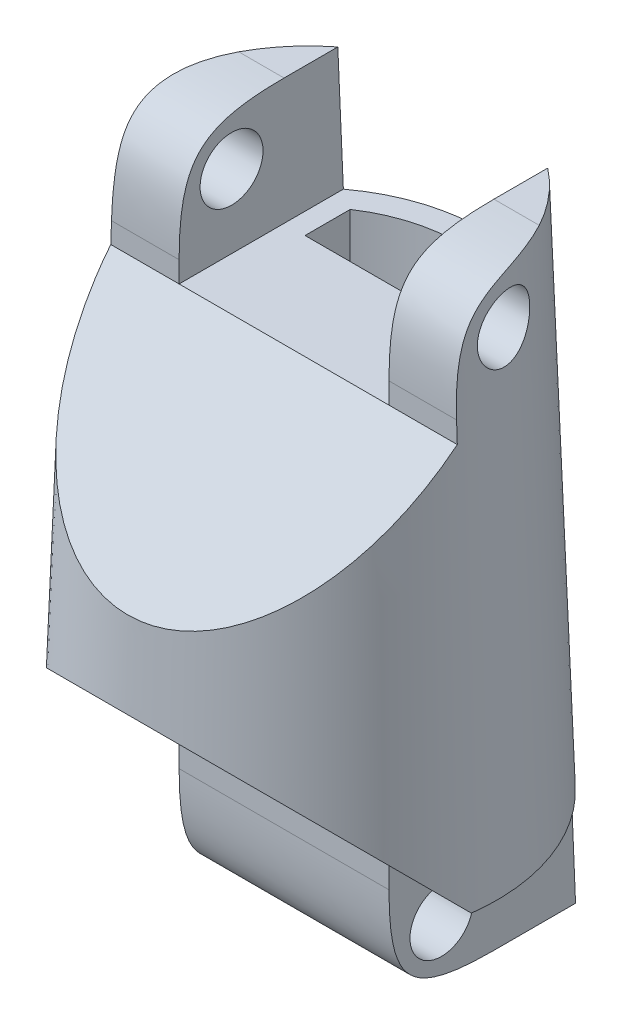
from build123d import *

# Parameters (mm, degrees)
SKETCH1_R                     = 9
BOSS_EXTRUDE1_DEPTH           = 25
BOSS_EXTRUDE1_TAPER           = 2
BOSS_EXTRUDE1_OTHER_WAY_DEPTH = 6
BOSS_EXTRUDE1_OTHER_WAY_TAPER = -2
CUT_EXTRUDE1_DEPTH            = 29.189194514
CUT_EXTRUDE1_DEPTH_BACK       = 29.189194514
CUT_EXTRUDE2_START            = -10.365035118
CUT_EXTRUDE2_OUTLINE_W        = 9.770566763
CUT_EXTRUDE2_OUTLINE_H        = 6
CUT_EXTRUDE2_DEPTH            = 10.365035118
CUT_EXTRUDE3_DEPTH            = 31.096766332
CUT_EXTRUDE3_DEPTH_BACK       = 31.096766332
SKETCH5_R                     = 1.5
FILLET1_SIZE                  = 5
CUT_EXTRUDE4_DEPTH            = 29.121439218
CUT_EXTRUDE4_DEPTH_BACK       = 29.121439218
SKETCH8_W                     = 10
SKETCH8_H                     = 6
CUT_EXTRUDE5_DEPTH            = 29.520763505
CUT_EXTRUDE6_DEPTH            = 31.096766332
CUT_EXTRUDE6_DEPTH_BACK       = 31.096766332
SKETCH9_R                     = 1.5
FILLET2_SIZE                  = 5
CUT_EXTRUDE7_DEPTH            = 34.568070447


with BuildPart() as part:
    # Sketch1 → Boss-Extrude1 (new body)
    with BuildSketch(Plane(origin=(0, 0, 0), x_dir=(1, 0, 0), z_dir=(0, 1, 0))):
        Circle(SKETCH1_R)
    extrude(amount=BOSS_EXTRUDE1_DEPTH, taper=BOSS_EXTRUDE1_TAPER)

    # Sketch1 → Boss-Extrude1 other way (add)
    with BuildSketch(Plane(origin=(0, 0, 0), x_dir=(1, 0, 0), z_dir=(0, 1, 0))):
        Circle(SKETCH1_R)
    extrude(amount=-BOSS_EXTRUDE1_OTHER_WAY_DEPTH, taper=BOSS_EXTRUDE1_OTHER_WAY_TAPER)

    # Sketch3 → Cut-Extrude1 (cut, two sides: drawn at the far end of the back side and taken through both)
    with BuildSketch(Plane(origin=(0, 0, 0), x_dir=(0, 0, -1), z_dir=(1, 0, 0)).offset(-CUT_EXTRUDE1_DEPTH_BACK)):
        Polygon((-1.155510401, -6), (-1.155510401, 0), (-11.155510401, 10), (-11.155510401, -6), align=None)
    extrude(amount=CUT_EXTRUDE1_DEPTH + CUT_EXTRUDE1_DEPTH_BACK, mode=Mode.SUBTRACT)

    # Cut-Extrude2: read off the stored shape, not the designer's step
    # Cut-Extrude2 outline → Cut-Extrude2 (cut)
    with BuildSketch(Plane.XY.offset(1.155510401).offset(CUT_EXTRUDE2_START)):
        with Locations((-9.885283382, -3)):
            Rectangle(CUT_EXTRUDE2_OUTLINE_W, CUT_EXTRUDE2_OUTLINE_H)
        with Locations((9.885283382, -3)):
            Rectangle(CUT_EXTRUDE2_OUTLINE_W, CUT_EXTRUDE2_OUTLINE_H)
    extrude(amount=CUT_EXTRUDE2_DEPTH, mode=Mode.SUBTRACT)

    # Sketch5 → Cut-Extrude3 (cut, two sides: drawn at the far end of the back side and taken through both)
    with BuildSketch(Plane.ZY.offset(5).offset(-CUT_EXTRUDE3_DEPTH_BACK)):
        with Locations(Location((-1.344489599, -3.5, 0), (0, 0, 270))):
            Circle(SKETCH5_R)
    extrude(amount=CUT_EXTRUDE3_DEPTH + CUT_EXTRUDE3_DEPTH_BACK, mode=Mode.SUBTRACT)

    # Fillet1
    # a fillet whose section is not a circle: 5 mm, written as the material it takes off along each edge
    with BuildSketch(Plane(origin=(17.5, -6, 1.155510401), x_dir=(0, 0, -1), z_dir=(-1, 0, 0))) as fillet1_piece_1:
        with BuildLine():
            Bezier((FILLET1_SIZE, 0), (0, 0), (0, -FILLET1_SIZE), weights=[1, 1.5, 1])
            Line((0, -FILLET1_SIZE), (0, 0))
            Line((0, 0), (FILLET1_SIZE, 0))
        make_face()
    extrude(amount=35, mode=Mode.SUBTRACT)

    # Sketch7 → Cut-Extrude4 (cut, two sides: drawn at the far end of the back side and taken through both)
    with BuildSketch(Plane(origin=(0, 0, 0), x_dir=(0, 0, -1), z_dir=(1, 0, 0)).offset(-CUT_EXTRUDE4_DEPTH_BACK)):
        Polygon((-1.155510401, 25), (-1.155510401, 19), (-12.24506556, 7.91044484), (-12.24506556, 25), align=None)
    extrude(amount=CUT_EXTRUDE4_DEPTH + CUT_EXTRUDE4_DEPTH_BACK, mode=Mode.SUBTRACT)

    # Sketch8 → Cut-Extrude5 (cut, through all)
    with BuildSketch(Plane.XY.offset(1.155510401)):
        with Locations((0, 22)):
            Rectangle(SKETCH8_W, SKETCH8_H)
    extrude(amount=-CUT_EXTRUDE5_DEPTH, mode=Mode.SUBTRACT)

    # Sketch9 → Cut-Extrude6 (cut, two sides: drawn at the far end of the back side and taken through both)
    with BuildSketch(Plane(origin=(-5, 0, 0), x_dir=(0, 0, -1), z_dir=(1, 0, 0)).offset(-CUT_EXTRUDE6_DEPTH_BACK)):
        with Locations(Location((1.344489599, 22.5, 0), (0, 0, 311.001081294))):
            Circle(SKETCH9_R)
    extrude(amount=CUT_EXTRUDE6_DEPTH + CUT_EXTRUDE6_DEPTH_BACK, mode=Mode.SUBTRACT)

    # Fillet2
    # a fillet whose section is not a circle: 5 mm, written as the material it takes off along each edge
    with BuildSketch(Plane(origin=(-20.544414959, 25, 1.155510401), x_dir=(0, 0, -1), z_dir=(1, 0, 0))) as fillet2_piece_1:
        with BuildLine():
            Bezier((FILLET2_SIZE, 0), (0, 0), (0, -FILLET2_SIZE), weights=[1, 1.5, 1])
            Line((0, -FILLET2_SIZE), (0, 0))
            Line((0, 0), (FILLET2_SIZE, 0))
        make_face()
    extrude(amount=28.044414959, mode=Mode.SUBTRACT)
    with BuildSketch(Plane(origin=(-7.5, 25, 1.155510401), x_dir=(0, -1, 0), z_dir=(1, 0, 0))) as fillet2_piece_2:
        with BuildLine():
            Bezier((FILLET2_SIZE, 0), (0, 0), (0, FILLET2_SIZE), weights=[1, 1.5, 1])
            Line((0, FILLET2_SIZE), (0, 0))
            Line((0, 0), (FILLET2_SIZE, 0))
        make_face()
    extrude(amount=28.044414959, mode=Mode.SUBTRACT)

    # Sketch10 → Cut-Extrude7 (cut, through all)
    with BuildSketch(Plane.XZ.offset(6)):
        with BuildLine():
            Line((-4, -3.844489599), (-4, -5.998103467))
            ThreePointArc((-4, -5.998103467), (0, -7.209524617), (4, -5.998103467))
            Line((4, -5.998103467), (4, -3.844489599))
            Line((4, -3.844489599), (-4, -3.844489599))
        make_face()
    extrude(amount=-CUT_EXTRUDE7_DEPTH, mode=Mode.SUBTRACT)


solid = part.part
